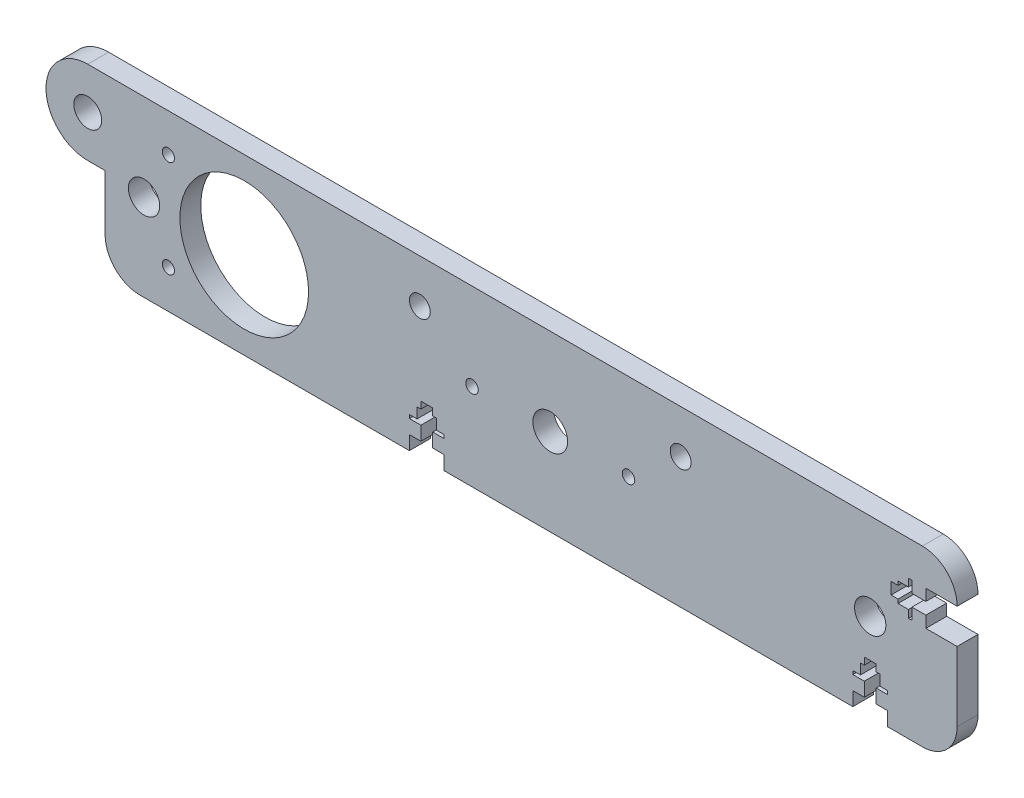
from build123d import *

# Parameters (mm, degrees)
ESBO_O1_R                = 1.75
ESBO_O1_R_2              = 4.5
ESBO_O1_R_3              = 18.5
ESBO_O1_R_4              = 1.8
ESBO_O1_R_5              = 4
ESBO_O1_R_6              = 3
ESBO_O1_R_7              = 5
RESSALTO_EXTRUS_O1_DEPTH = 6


with BuildPart() as part:
    # Esboço1 → Ressalto-extrusão1 (new body)
    with BuildSketch(Plane.XY):
        with BuildLine():
            Line((105, -21), (105, -25))
            Line((105, -25), (115, -25))
            ThreePointArc((115, -25), (122.071067812, -22.071067812), (125, -15))
            Line((125, -15), (125, 5))
            Line((125, 5), (116, 5))
            Line((116, 5), (116, 8.3))
            Line((116, 8.3), (112, 8.3))
            Line((112, 8.3), (112, 5))
            Line((112, 5), (111, 5))
            Line((111, 5), (111, 7.2))
            Line((111, 7.2), (108, 7.2))
            Line((108, 7.2), (108, 8.3))
            Line((108, 8.3), (106, 8.3))
            Line((106, 8.3), (106, 11.7))
            Line((106, 11.7), (108, 11.7))
            Line((108, 11.7), (108, 12.8))
            Line((108, 12.8), (111, 12.8))
            Line((111, 12.8), (111, 15))
            Line((111, 15), (112, 15))
            Line((112, 15), (112, 11.7))
            Line((112, 11.7), (116, 11.7))
            Line((116, 11.7), (116, 15))
            Line((116, 15), (125, 15))
            ThreePointArc((125, 15), (122.071067812, 22.071067812), (115, 25))
            Line((115, 25), (-125, 25))
            ThreePointArc((-125, 25), (-137, 13), (-125, 1))
            Line((-125, 1), (-120, 1))
            Line((-120, 1), (-120, -15))
            ThreePointArc((-120, -15), (-117.071067812, -22.071067812), (-110, -25))
            Line((-110, -25), (-32.5, -25))
            Line((-32.5, -25), (-32.5, -21))
            Line((-32.5, -21), (-29.2, -21))
            Line((-29.2, -21), (-29.2, -17))
            Line((-29.2, -17), (-32.5, -17))
            Line((-32.5, -17), (-32.5, -16))
            Line((-32.5, -16), (-30.3, -16))
            Line((-30.3, -16), (-30.3, -13))
            Line((-30.3, -13), (-29.2, -13))
            Line((-29.2, -13), (-29.2, -11))
            Line((-29.2, -11), (-25.8, -11))
            Line((-25.8, -11), (-25.8, -13))
            Line((-25.8, -13), (-24.7, -13))
            Line((-24.7, -13), (-24.7, -16))
            Line((-24.7, -16), (-22.5, -16))
            Line((-22.5, -16), (-22.5, -17))
            Line((-22.5, -17), (-25.8, -17))
            Line((-25.8, -17), (-25.8, -21))
            Line((-25.8, -21), (-22.5, -21))
            Line((-22.5, -21), (-22.5, -25))
            Line((-22.5, -25), (95, -25))
            Line((95, -25), (95, -21))
            Line((95, -21), (98.3, -21))
            Line((98.3, -21), (98.3, -17))
            Line((98.3, -17), (95, -17))
            Line((95, -17), (95, -16))
            Line((95, -16), (97.2, -16))
            Line((97.2, -16), (97.2, -13))
            Line((97.2, -13), (98.3, -13))
            Line((98.3, -13), (98.3, -11))
            Line((98.3, -11), (101.7, -11))
            Line((101.7, -11), (101.7, -13))
            Line((101.7, -13), (102.8, -13))
            Line((102.8, -13), (102.8, -16))
            Line((102.8, -16), (105, -16))
            Line((105, -16), (105, -17))
            Line((105, -17), (101.7, -17))
            Line((101.7, -17), (101.7, -21))
            Line((101.7, -21), (105, -21))
        make_face()
        with Locations((-101.81, -14)):
            Circle(ESBO_O1_R, mode=Mode.SUBTRACT)
        with Locations((-108.81, 0)):
            Circle(ESBO_O1_R_2, mode=Mode.SUBTRACT)
        with Locations((-80, 0)):
            Circle(ESBO_O1_R_3, mode=Mode.SUBTRACT)
        with Locations((-14.5, 0)):
            Circle(ESBO_O1_R_4, mode=Mode.SUBTRACT)
        with Locations((-125, 13)):
            Circle(ESBO_O1_R_5, mode=Mode.SUBTRACT)
        with Locations((-101.81, 14)):
            Circle(ESBO_O1_R, mode=Mode.SUBTRACT)
        with Locations((-29.5, 12.5)):
            Circle(ESBO_O1_R_6, mode=Mode.SUBTRACT)
        with Locations((8, 0)):
            Circle(ESBO_O1_R_7, mode=Mode.SUBTRACT)
        with Locations((30.5, 0)):
            Circle(ESBO_O1_R_4, mode=Mode.SUBTRACT)
        with Locations((100, 0)):
            Circle(ESBO_O1_R_2, mode=Mode.SUBTRACT)
        with Locations((45.5, 12.5)):
            Circle(ESBO_O1_R_6, mode=Mode.SUBTRACT)
    extrude(amount=RESSALTO_EXTRUS_O1_DEPTH)


solid = part.part
